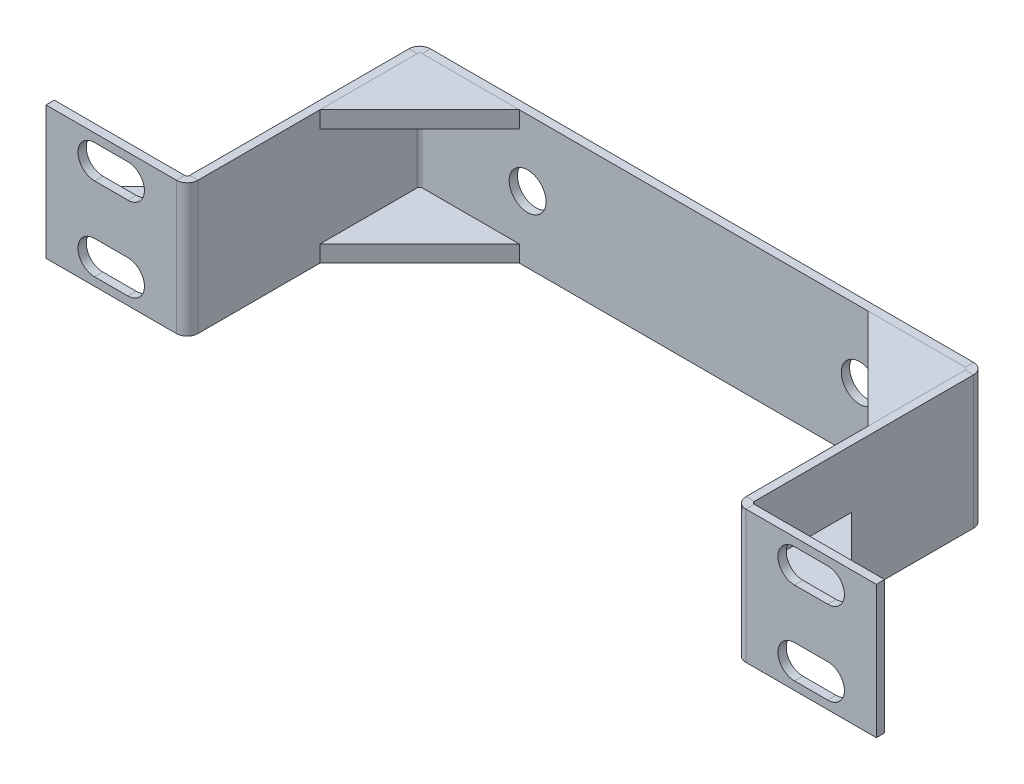
from build123d import *

# Parameters (mm, degrees)
BASE_FLANGE1_DEPTH = 40
GUSSET5_THICKNESS  = 5
GUSSET7_THICKNESS  = 5
SKETCH10_R         = 5.55625
CUT_EXTRUDE2_DEPTH = 150.937486974
GUSSET9_THICKNESS  = 5
GUSSET10_THICKNESS = 5
GUSSET11_THICKNESS = 5
GUSSET12_THICKNESS = 5
CUT_EXTRUDE3_DEPTH = 149.744747806


# Sheet-metal steps are written as plain solids
with BuildPart() as part:
    # Sketch1 → Base-Flange1 (new body)
    with BuildSketch(Plane(origin=(0, 0, 0), x_dir=(1, 0, 0), z_dir=(0, 1, 0))):
        with BuildLine():
            Line((-125, 0), (-85.7366, 0))
            ThreePointArc((-85.7366, 0), (-85.215745145, 0.215745145), (-85, 0.7366))
            Line((-85, 0.7366), (-85, 66.7634))
            ThreePointArc((-85, 66.7634), (-84.052021808, 69.052021808), (-81.7634, 70))
            Line((-81.7634, 70), (81.7634, 70))
            ThreePointArc((81.7634, 70), (84.052021808, 69.052021808), (85, 66.7634))
            Line((85, 66.7634), (85, 0.7366))
            ThreePointArc((85, 0.7366), (85.215745145, 0.215745145), (85.7366, 0))
            Line((85.7366, 0), (125, 0))
            Line((125, 0), (125, -2.5))
            Line((125, -2.5), (85.7366, -2.5))
            ThreePointArc((85.7366, -2.5), (83.447978192, -1.552021808), (82.5, 0.7366))
            Line((82.5, 0.7366), (82.5, 66.7634))
            ThreePointArc((82.5, 66.7634), (82.284254855, 67.284254855), (81.7634, 67.5))
            Line((81.7634, 67.5), (-81.7634, 67.5))
            ThreePointArc((-81.7634, 67.5), (-82.284254855, 67.284254855), (-82.5, 66.7634))
            Line((-82.5, 66.7634), (-82.5, 0.7366))
            ThreePointArc((-82.5, 0.7366), (-83.447978192, -1.552021808), (-85.7366, -2.5))
            Line((-85.7366, -2.5), (-125, -2.5))
            Line((-125, -2.5), (-125, 0))
        make_face()
    extrude(amount=BASE_FLANGE1_DEPTH)

    # Sketch10 → Cut-Extrude2 (cut, through all)
    with BuildSketch(Plane(origin=(0, 0, -70), x_dir=(-1, 0, 0), z_dir=(0, 0, -1))):
        with Locations((-50, 20)):
            Circle(SKETCH10_R)
        with Locations((50, 20)):
            Circle(SKETCH10_R)
    extrude(amount=-CUT_EXTRUDE2_DEPTH, mode=Mode.SUBTRACT)

    # Sketch15 → Cut-Extrude3 (cut, through all)
    with BuildSketch(Plane(origin=(0, 0, 0), x_dir=(-1, 0, 0), z_dir=(0, 0, -1))):
        with BuildLine():
            Line((-110.3683, 12.5), (-100.3683, 12.5))
            ThreePointArc((-100.3683, 12.5), (-95.3683, 7.5), (-100.3683, 2.5))
            Line((-100.3683, 2.5), (-110.3683, 2.5))
            ThreePointArc((-110.3683, 2.5), (-115.3683, 7.5), (-110.3683, 12.5))
        make_face()
        with BuildLine():
            Line((110.3683, 12.5), (100.3683, 12.5))
            ThreePointArc((100.3683, 12.5), (95.3683, 7.5), (100.3683, 2.5))
            Line((100.3683, 2.5), (110.3683, 2.5))
            ThreePointArc((110.3683, 2.5), (115.3683, 7.5), (110.3683, 12.5))
        make_face()
        with BuildLine():
            Line((-110.3683, 27.5), (-100.3683, 27.5))
            ThreePointArc((-100.3683, 27.5), (-95.3683, 32.5), (-100.3683, 37.5))
            Line((-100.3683, 37.5), (-110.3683, 37.5))
            ThreePointArc((-110.3683, 37.5), (-115.3683, 32.5), (-110.3683, 27.5))
        make_face()
        with BuildLine():
            Line((110.3683, 27.5), (100.3683, 27.5))
            ThreePointArc((100.3683, 27.5), (95.3683, 32.5), (100.3683, 37.5))
            Line((100.3683, 37.5), (110.3683, 37.5))
            ThreePointArc((110.3683, 37.5), (115.3683, 32.5), (110.3683, 27.5))
        make_face()
    extrude(amount=-CUT_EXTRUDE3_DEPTH, mode=Mode.SUBTRACT)


with BuildPart() as body_2:
    # Gusset5: a gusset: a plate 5.0 thick in the corner of two members, its outline drawn in place
    gusset5_outline = Wire([Line((-85, 17.5, 0), (-115, 17.5, 0)), Line((-115, 17.5, 0), (-85, 17.5, -30)), Line((-85, 17.5, -30), (-85, 17.5, 0))])
    add(extrude(Face(gusset5_outline), amount=GUSSET5_THICKNESS, dir=(0, 1, 0)))


with BuildPart() as body_3:
    # Gusset7: a gusset: a plate 5.0 thick in the corner of two members, its outline drawn in place
    gusset7_outline = Wire([Line((85, 17.5, 0), (85, 17.5, -30)), Line((85, 17.5, -30), (115, 17.5, 0)), Line((115, 17.5, 0), (85, 17.5, 0))])
    add(extrude(Face(gusset7_outline), amount=GUSSET7_THICKNESS, dir=(0, 1, 0)))


with BuildPart() as body_4:
    # Gusset9: a gusset: a plate 5.0 thick in the corner of two members, its outline drawn in place
    gusset9_outline = Wire([Line((-82.5, 35, -67.5), (-52.5, 35, -67.5)), Line((-52.5, 35, -67.5), (-82.5, 35, -37.5)), Line((-82.5, 35, -37.5), (-82.5, 35, -67.5))])
    add(extrude(Face(gusset9_outline), amount=GUSSET9_THICKNESS, dir=(0, 1, 0)))


with BuildPart() as body_5:
    # Gusset10: a gusset: a plate 5.0 thick in the corner of two members, its outline drawn in place
    gusset10_outline = Wire([Line((-82.5, 5, -67.5), (-82.5, 5, -37.5)), Line((-82.5, 5, -37.5), (-52.5, 5, -67.5)), Line((-52.5, 5, -67.5), (-82.5, 5, -67.5))])
    add(extrude(Face(gusset10_outline), amount=GUSSET10_THICKNESS, dir=(0, -1, 0)))


with BuildPart() as body_6:
    # Gusset11: a gusset: a plate 5.0 thick in the corner of two members, its outline drawn in place
    gusset11_outline = Wire([Line((82.5, 5, -67.5), (52.5, 5, -67.5)), Line((52.5, 5, -67.5), (82.5, 5, -37.5)), Line((82.5, 5, -37.5), (82.5, 5, -67.5))])
    add(extrude(Face(gusset11_outline), amount=GUSSET11_THICKNESS, dir=(0, -1, 0)))


with BuildPart() as body_7:
    # Gusset12: a gusset: a plate 5.0 thick in the corner of two members, its outline drawn in place
    gusset12_outline = Wire([Line((82.5, 40, -67.5), (52.5, 40, -67.5)), Line((52.5, 40, -67.5), (82.5, 40, -37.5)), Line((82.5, 40, -37.5), (82.5, 40, -67.5))])
    add(extrude(Face(gusset12_outline), amount=GUSSET12_THICKNESS, dir=(0, -1, 0)))


solid = Compound([part.part, body_2.part, body_3.part, body_4.part, body_5.part, body_6.part, body_7.part])
